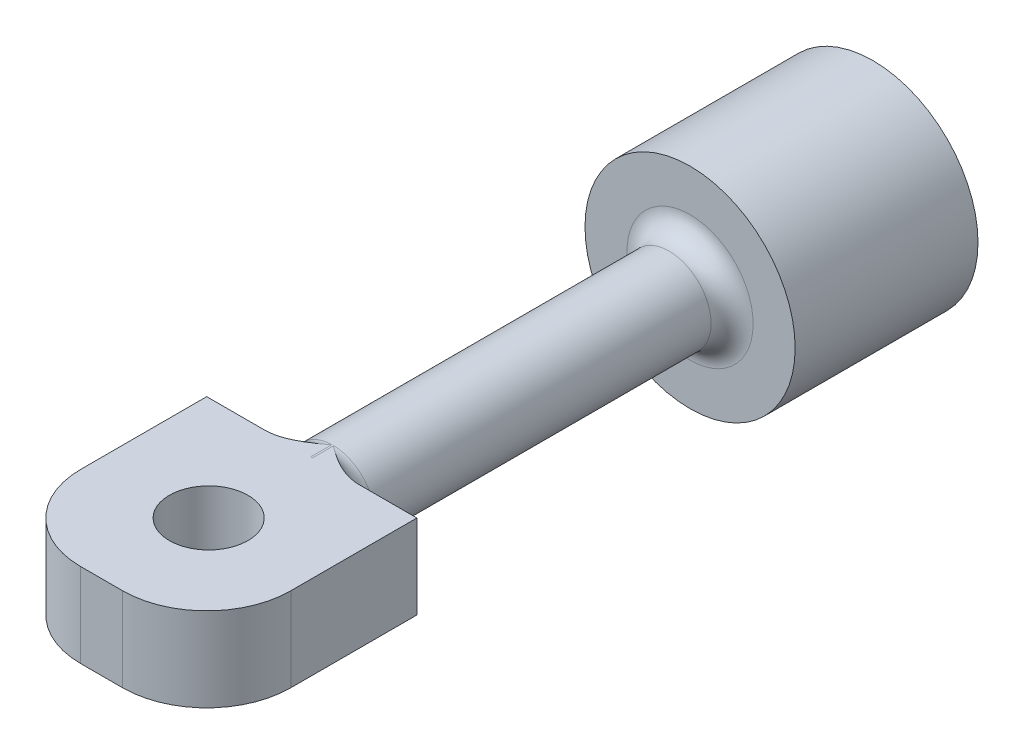
from build123d import *

# Parameters (mm, degrees)
SKETCH1_R           = 6.35
BOSS_EXTRUDE1_DEPTH = 11.049
SKETCH2_R           = 2.54
BOSS_EXTRUDE2_DEPTH = 22.86
SKETCH3_W           = 12.7
SKETCH3_H           = 5.078733264
BOSS_EXTRUDE3_DEPTH = 12.7
SKETCH4_R           = 2.3749
CUT_EXTRUDE1_DEPTH  = 12.7
FILLET2_R           = 5.08
FILLET3_R           = 5.08
FILLET5_R           = 1.27


with BuildPart() as part:
    # Sketch1 → Boss-Extrude1 (new body)
    with BuildSketch(Plane.XY):
        with Locations((-5.609264719, 0)):
            Circle(SKETCH1_R)
    extrude(amount=BOSS_EXTRUDE1_DEPTH)

    # Sketch2 → Boss-Extrude2 (add)
    with BuildSketch(Plane.XY.offset(11.049)):
        with Locations((-5.609264719, 0)):
            Circle(SKETCH2_R)
    extrude(amount=BOSS_EXTRUDE2_DEPTH)

    # Sketch3 → Boss-Extrude3 (add)
    with BuildSketch(Plane.XY.offset(33.909)):
        with Locations((-5.609264719, 0)):
            Rectangle(SKETCH3_W, SKETCH3_H)
    extrude(amount=BOSS_EXTRUDE3_DEPTH)

    # Sketch4 → Cut-Extrude1 (cut)
    with BuildSketch(Plane.XZ.offset(2.539366632)):
        with Locations(Location((-5.552545155, 40.197708747, 0), (0, 0, 270))):
            Circle(SKETCH4_R)
    extrude(amount=-CUT_EXTRUDE1_DEPTH, mode=Mode.SUBTRACT)

    # Fillet2
    fillet2_edges = [part.edges().sort_by_distance(p)[0] for p in [
        (0.740735281, 0, 46.609),
    ]]
    fillet(fillet2_edges, radius=FILLET2_R)

    # Fillet3
    fillet3_edges = [part.edges().sort_by_distance(p)[0] for p in [
        (-11.959264719, 0, 46.609),
    ]]
    fillet(fillet3_edges, radius=FILLET3_R)

    # Fillet5
    # the kernel refuses this fillet: 1.27 mm, written as the material it adds along each edge
    with BuildSketch(Plane(origin=(-5.609264719, 0, 11.049), x_dir=(1, 0, 0), z_dir=(0, -1, 0))) as fillet5_piece_1:
        with BuildLine():
            CenterArc((2.54 + FILLET5_R, FILLET5_R), FILLET5_R, 180, 90)
            Line((2.54 + FILLET5_R, 0), (2.54, 0))
            Line((2.54, 0), (2.54, FILLET5_R))
        make_face()
    revolve(axis=Axis((-5.609264719, 0, 11.049), (0, 0, 1)))
    with BuildSketch(Plane(origin=(-5.609264719, 0, 33.909), x_dir=(-0.9418707182707275, -0.3359755200370762, 0), z_dir=(-0.3359755200370762, 0.9418707182707275, 0))) as fillet5_piece_2_section:
        with BuildLine():
            CenterArc((2.54 + FILLET5_R, -FILLET5_R), FILLET5_R, 90, 90)
            Line((2.54, -FILLET5_R), (2.54, 0))
            Line((2.54, 0), (2.54 + FILLET5_R, 0))
        make_face()
    fillet5_piece_2 = revolve(axis=Axis((-5.609264719, 0, 33.909), (0, 0, 1)), revolution_arc=160.368130272, mode=Mode.PRIVATE)
    fillet5_piece_2 = split(fillet5_piece_2, bisect_by=Plane(origin=(-7.562831834, -2.539366632, 33.60366216), z_dir=(0, 1, 0)), keep=Keep.TOP, mode=Mode.PRIVATE)
    add(fillet5_piece_2)
    with BuildSketch(Plane(origin=(-5.609264719, 0, 33.909), x_dir=(0.9423620673245245, 0.3345948805164961, 0), z_dir=(0.3345948805164961, -0.9423620673245245, 0))) as fillet5_piece_3_section:
        with BuildLine():
            CenterArc((2.54 + FILLET5_R, -FILLET5_R), FILLET5_R, 90, 90)
            Line((2.54, -FILLET5_R), (2.54, 0))
            Line((2.54, 0), (2.54 + FILLET5_R, 0))
        make_face()
    fillet5_piece_3 = revolve(axis=Axis((-5.609264719, 0, 33.909), (0, 0, 1)), revolution_arc=320.904190545, mode=Mode.PRIVATE)
    fillet5_piece_3 = split(fillet5_piece_3, bisect_by=Plane(origin=(-3.654388509, -2.539366632, 33.60372255), z_dir=(0, 1, 0)), keep=Keep.TOP, mode=Mode.PRIVATE)
    fillet5_piece_3 = split(fillet5_piece_3, bisect_by=Plane(origin=(-3.654388509, 2.539366632, 33.60372255), z_dir=(0, -1, 0)), keep=Keep.TOP, mode=Mode.PRIVATE)
    add(fillet5_piece_3)
    with BuildSketch(Plane(origin=(-5.609264719, 0, 33.909), x_dir=(1, 0, 0), z_dir=(0, -1, 0))) as fillet5_piece_4_section:
        with BuildLine():
            CenterArc((2.54 + FILLET5_R, -FILLET5_R), FILLET5_R, 90, 90)
            Line((2.54, -FILLET5_R), (2.54, 0))
            Line((2.54, 0), (2.54 + FILLET5_R, 0))
        make_face()
    fillet5_piece_4 = revolve(axis=Axis((-5.609264719, 0, 33.909), (0, 0, 1)), revolution_arc=160.368130272, mode=Mode.PRIVATE)
    fillet5_piece_4 = split(fillet5_piece_4, bisect_by=Plane(origin=(-3.407688785, 2.539366632, 33.61360523), z_dir=(0, -1, 0)), keep=Keep.TOP, mode=Mode.PRIVATE)
    add(fillet5_piece_4)


solid = part.part
